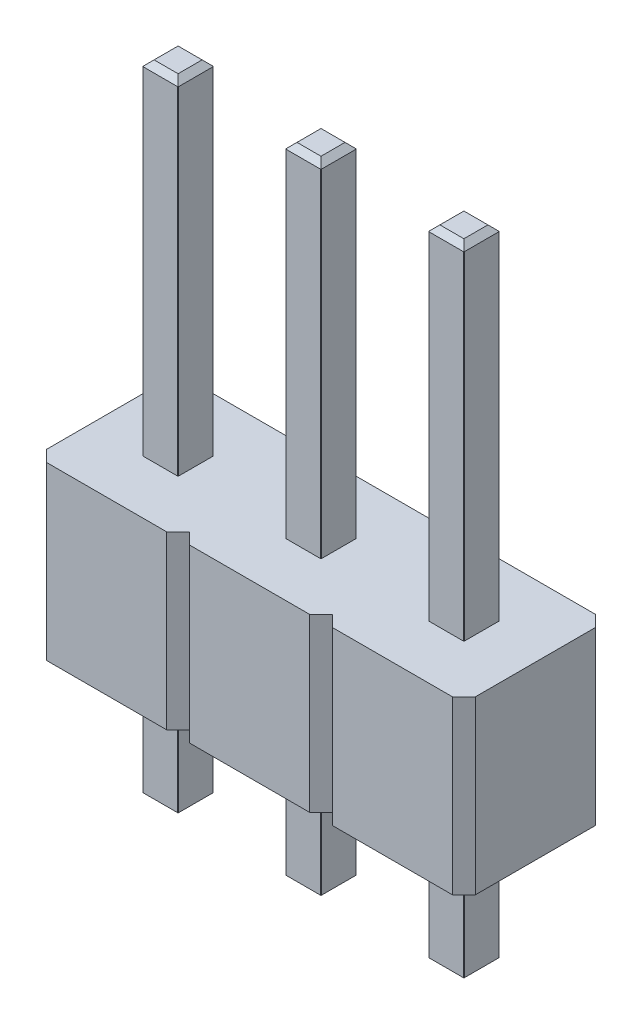
from build123d import *

# Parameters (mm, degrees)
BOSS_EXTRUDE1_DEPTH      = 3
BOSS_EXTRUDE2_DEPTH      = 6
BOSS_EXTRUDE2_DEPTH_BACK = 5.2
CHAMFER1_SIZE            = 0.1


with BuildPart() as part:
    # Sketch2 → Boss-Extrude1 (new body)
    with BuildSketch(Plane(origin=(0, 0, 0), x_dir=(1, 0, 0), z_dir=(0, 1, 0))):
        Polygon((-1.25, -1.05), (-1.05, -1.25), (1.05, -1.25), (1.25, -1.05), (1.45, -1.25), (3.55, -1.25), (3.75, -1.05), (3.75, 1.05), (3.55, 1.25), (1.45, 1.25), (1.25, 1.05), (1.05, 1.25), (-1.05, 1.25), (-1.25, 1.05), (-1.45, 1.25), (-3.55, 1.25), (-3.75, 1.05), (-3.75, -1.05), (-3.55, -1.25), (-1.45, -1.25), align=None)
    extrude(amount=BOSS_EXTRUDE1_DEPTH)

    # Sketch3 → Boss-Extrude2 (add, two sides: drawn at the far end of the back side and taken through both)
    with BuildSketch(Plane(origin=(0, 3, 0), x_dir=(1, 0, 0), z_dir=(0, 1, 0)).offset(-BOSS_EXTRUDE2_DEPTH_BACK)):
        Polygon((0.3, 0.31), (-0.3, 0.31), (-0.31, 0.3), (-0.31, -0.3), (-0.3, -0.31), (0.3, -0.31), (0.31, -0.3), (0.31, 0.3), align=None)
        Polygon((-2.2, -0.31), (-2.19, -0.3), (-2.19, 0.3), (-2.2, 0.31), (-2.8, 0.31), (-2.81, 0.3), (-2.81, -0.3), (-2.8, -0.31), align=None)
        Polygon((2.8, -0.31), (2.81, -0.3), (2.81, 0.3), (2.8, 0.31), (2.2, 0.31), (2.19, 0.3), (2.19, -0.3), (2.2, -0.31), align=None)
    extrude(amount=BOSS_EXTRUDE2_DEPTH + BOSS_EXTRUDE2_DEPTH_BACK)

    # Chamfer1
    # the kernel refuses this chamfer: 0.1 mm, written as the material it takes off along each edge
    with BuildSketch(Plane(origin=(-2.81, 9, -0.557168299), x_dir=(-0.027495876610587656, -0.9996219169112966, 0), z_dir=(0, 0, 1)), Plane(origin=(-1.942831701, 9, -0.31), x_dir=(0, -0.9996219169112968, -0.02749587661058658), z_dir=(-1, 0, 0)), Plane(origin=(-2.19, 9, 0.557168299), x_dir=(0.027495876610587656, -0.9996219169112966, 0), z_dir=(0, 0, -1)), Plane(origin=(-3.057168299, 9, 0.31), x_dir=(0, -0.9996219169112968, 0.02749587661058658), z_dir=(1, 0, 0)), Plane(origin=(2.19, 9, -0.557168299), x_dir=(-0.027495876610587656, -0.9996219169112966, 0), z_dir=(0, 0, 1)), Plane(origin=(3.057168299, 9, -0.31), x_dir=(0, -0.9996219169112968, -0.02749587661058658), z_dir=(-1, 0, 0)), Plane(origin=(2.81, 9, 0.557168299), x_dir=(0.027495876610587656, -0.9996219169112966, 0), z_dir=(0, 0, -1)), Plane(origin=(1.942831701, 9, 0.31), x_dir=(0, -0.9996219169112968, 0.02749587661058658), z_dir=(1, 0, 0)), Plane(origin=(0.557168299, 9, -0.31), x_dir=(0, -0.9996219169112968, -0.02749587661058658), z_dir=(-1, 0, 0)), Plane(origin=(0.31, 9, 0.557168299), x_dir=(0.027495876610586577, -0.9996219169112966, 0), z_dir=(0, 0, -1)), Plane(origin=(-0.557168299, 9, 0.31), x_dir=(0, -0.9996219169112968, 0.02749587661058658), z_dir=(1, 0, 0)), Plane(origin=(-0.31, 9, -0.557168299), x_dir=(-0.027495876610586577, -0.9996219169112966, 0), z_dir=(0, 0, 1))) as chamfer1_piece_1:
        Polygon((CHAMFER1_SIZE * 0.999621916911, CHAMFER1_SIZE * 0.0274958766106), (-CHAMFER1_SIZE * 0.0274958766106, CHAMFER1_SIZE * 0.999621916911), (0, 0), align=None)
    extrude(amount=1.114336598, mode=Mode.SUBTRACT)
    with BuildSketch(Plane(origin=(2.81, -2.2, 0.557168299), x_dir=(0.02749587661058718, 0.9996219169112966, 0), z_dir=(0, 0, -1)), Plane(origin=(3.057168299, -2.2, -0.31), x_dir=(0, 0.9996219169112968, -0.027495876610586105), z_dir=(-1, 0, 0)), Plane(origin=(2.19, -2.2, -0.557168299), x_dir=(-0.02749587661058718, 0.9996219169112966, 0), z_dir=(0, 0, 1)), Plane(origin=(1.942831701, -2.2, 0.31), x_dir=(0, 0.9996219169112968, 0.027495876610586105), z_dir=(1, 0, 0)), Plane(origin=(-0.31, -2.2, -0.557168299), x_dir=(-0.027495876610586105, 0.9996219169112968, 0), z_dir=(0, 0, 1)), Plane(origin=(-0.557168299, -2.2, 0.31), x_dir=(0, 0.9996219169112968, 0.027495876610586105), z_dir=(1, 0, 0)), Plane(origin=(0.31, -2.2, 0.557168299), x_dir=(0.027495876610586105, 0.9996219169112968, 0), z_dir=(0, 0, -1)), Plane(origin=(0.557168299, -2.2, -0.31), x_dir=(0, 0.9996219169112968, -0.027495876610586105), z_dir=(-1, 0, 0)), Plane(origin=(-2.19, -2.2, 0.557168299), x_dir=(0.02749587661058718, 0.9996219169112966, 0), z_dir=(0, 0, -1)), Plane(origin=(-1.942831701, -2.2, -0.31), x_dir=(0, 0.9996219169112968, -0.027495876610586105), z_dir=(-1, 0, 0)), Plane(origin=(-2.81, -2.2, -0.557168299), x_dir=(-0.02749587661058718, 0.9996219169112966, 0), z_dir=(0, 0, 1)), Plane(origin=(-3.057168299, -2.2, 0.31), x_dir=(0, 0.9996219169112968, 0.027495876610586105), z_dir=(1, 0, 0))) as chamfer1_piece_2:
        Polygon((CHAMFER1_SIZE * 0.999621916911, -CHAMFER1_SIZE * 0.0274958766106), (-CHAMFER1_SIZE * 0.0274958766106, -CHAMFER1_SIZE * 0.999621916911), (0, 0), align=None)
    extrude(amount=1.114336598, mode=Mode.SUBTRACT)


solid = part.part
